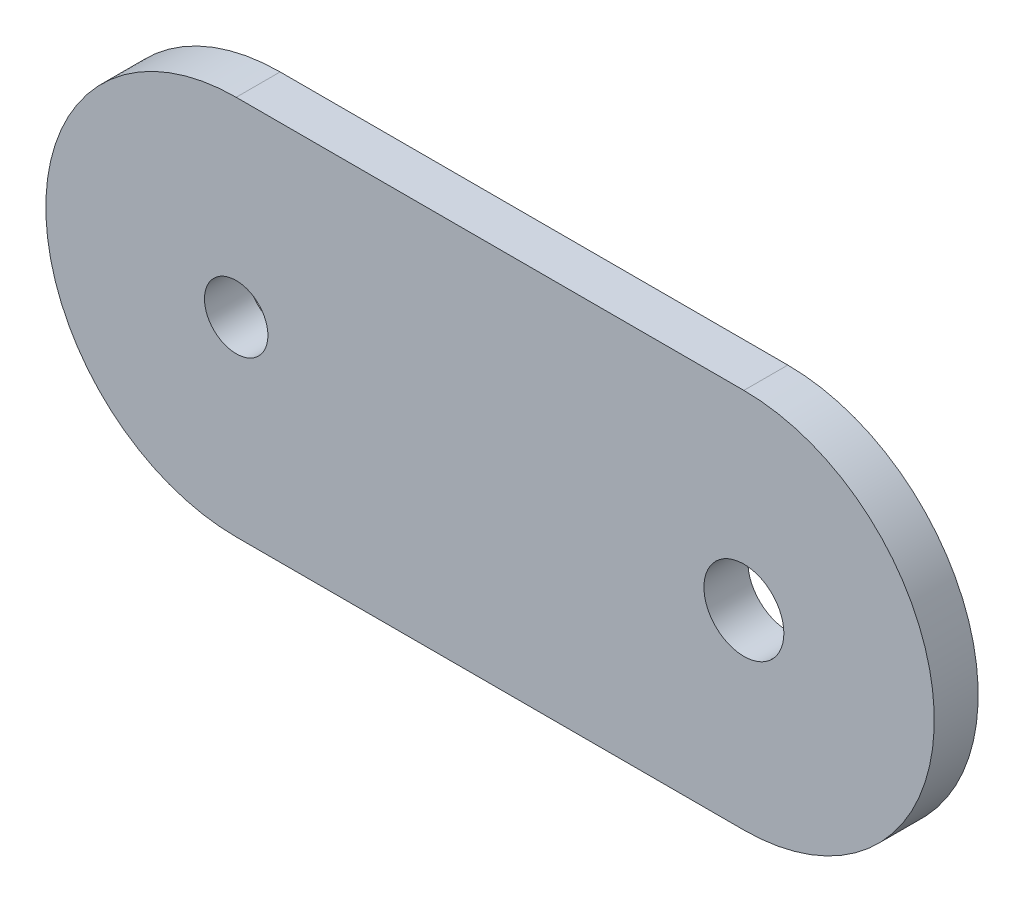
from build123d import *

# Parameters (mm, degrees)
SKETCH1_R           = 3.175
SKETCH1_R_2         = 4
BOSS_EXTRUDE1_DEPTH = 4.3942


with BuildPart() as part:
    # Sketch1 → Boss-Extrude1 (new body)
    with BuildSketch(Plane.XY):
        with BuildLine():
            Line((0, 19.05), (50.8, 19.05))
            ThreePointArc((50.8, 19.05), (69.85, 0), (50.8, -19.05))
            Line((50.8, -19.05), (0, -19.05))
            ThreePointArc((0, -19.05), (-19.05, 0), (0, 19.05))
        make_face()
        Circle(SKETCH1_R, mode=Mode.SUBTRACT)
        with Locations((50.8, 0)):
            Circle(SKETCH1_R_2, mode=Mode.SUBTRACT)
    extrude(amount=BOSS_EXTRUDE1_DEPTH)


solid = part.part
